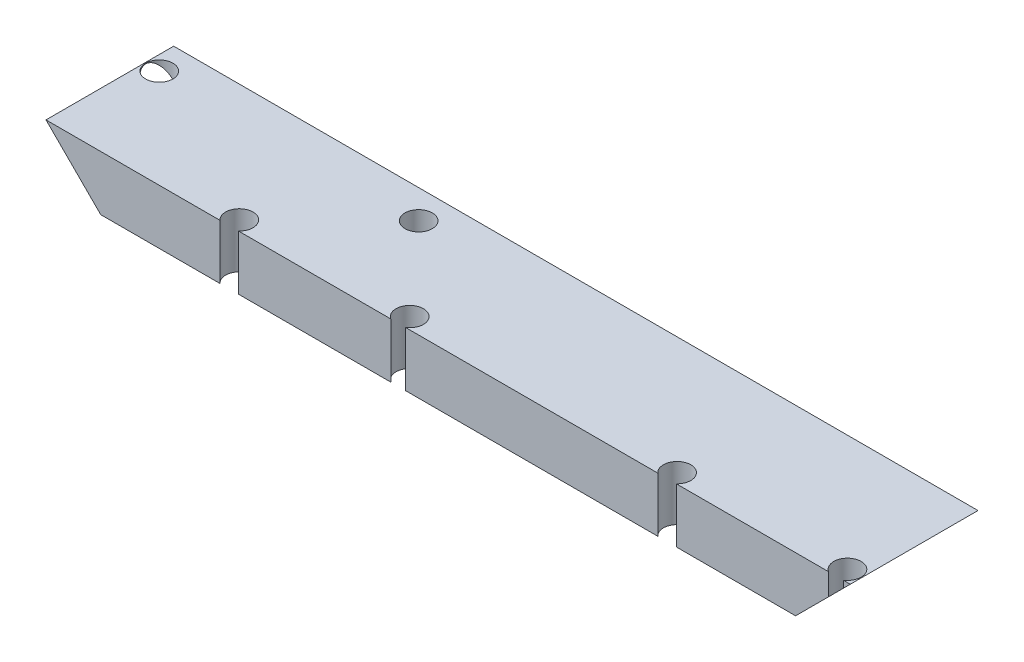
from build123d import *

# Parameters (mm, degrees)
SKETCH1_W                   = 560
SKETCH1_H                   = 88.9
BODY_DEPTH                  = 38.1
MOUNTING_HOLE_SPACING_REACH = 570.291
SKETCH2_R                   = 9.525
CUT_EXTRUDE1_REACH          = 570.291


with BuildPart() as part:
    # Sketch1 → Body (new body)
    with BuildSketch(Plane(origin=(0, 0, 0), x_dir=(1, 0, 0), z_dir=(0, 1, 0))):
        with Locations((280, 44.45)):
            Rectangle(SKETCH1_W, SKETCH1_H)
    extrude(amount=BODY_DEPTH)

    # Sketch2 → Mounting hole spacing (cut, up to next)
    with BuildSketch(Plane(origin=(0, 38.1, 0), x_dir=(1, 0, 0), z_dir=(0, 1, 0)), mode=Mode.PRIVATE) as mounting_hole_spacing_sk1:
        with Locations((127.6, 7)):
            Circle(SKETCH2_R)
    mounting_hole_spacing_tool1 = extrude(mounting_hole_spacing_sk1.sketch, amount=-MOUNTING_HOLE_SPACING_REACH, mode=Mode.PRIVATE) & part.part
    # Sketch2 → Mounting hole spacing (cut, up to next)
    with BuildSketch(Plane(origin=(0, 38.1, 0), x_dir=(1, 0, 0), z_dir=(0, 1, 0)), mode=Mode.PRIVATE) as mounting_hole_spacing_sk2:
        with Locations((190.57, 68.87)):
            Circle(SKETCH2_R)
    mounting_hole_spacing_tool2 = extrude(mounting_hole_spacing_sk2.sketch, amount=-MOUNTING_HOLE_SPACING_REACH, mode=Mode.PRIVATE) & part.part
    # Sketch2 → Mounting hole spacing (cut, up to next)
    with BuildSketch(Plane(origin=(0, 38.1, 0), x_dir=(1, 0, 0), z_dir=(0, 1, 0)), mode=Mode.PRIVATE) as mounting_hole_spacing_sk3:
        with Locations((10, 68.87)):
            Circle(SKETCH2_R)
    mounting_hole_spacing_tool3 = extrude(mounting_hole_spacing_sk3.sketch, amount=-MOUNTING_HOLE_SPACING_REACH, mode=Mode.PRIVATE) & part.part
    # Sketch2 → Mounting hole spacing (cut, up to next)
    with BuildSketch(Plane(origin=(0, 38.1, 0), x_dir=(1, 0, 0), z_dir=(0, 1, 0)), mode=Mode.PRIVATE) as mounting_hole_spacing_sk4:
        with Locations((245.2, 8.02)):
            Circle(SKETCH2_R)
    mounting_hole_spacing_tool4 = extrude(mounting_hole_spacing_sk4.sketch, amount=-MOUNTING_HOLE_SPACING_REACH, mode=Mode.PRIVATE) & part.part
    # Sketch2 → Mounting hole spacing (cut, up to next)
    with BuildSketch(Plane(origin=(0, 38.1, 0), x_dir=(1, 0, 0), z_dir=(0, 1, 0)), mode=Mode.PRIVATE) as mounting_hole_spacing_sk5:
        with Locations((550, 8.02)):
            Circle(SKETCH2_R)
    mounting_hole_spacing_tool5 = extrude(mounting_hole_spacing_sk5.sketch, amount=-MOUNTING_HOLE_SPACING_REACH, mode=Mode.PRIVATE) & part.part
    # Sketch2 → Mounting hole spacing (cut, up to next)
    with BuildSketch(Plane(origin=(0, 38.1, 0), x_dir=(1, 0, 0), z_dir=(0, 1, 0)), mode=Mode.PRIVATE) as mounting_hole_spacing_sk6:
        with Locations((432.4, 7)):
            Circle(SKETCH2_R)
    mounting_hole_spacing_tool6 = extrude(mounting_hole_spacing_sk6.sketch, amount=-MOUNTING_HOLE_SPACING_REACH, mode=Mode.PRIVATE) & part.part
    add(mounting_hole_spacing_tool1.solids().sort_by_distance((127.6, 38.1, -7))[0], mode=Mode.SUBTRACT)
    add(mounting_hole_spacing_tool2.solids().sort_by_distance((190.57, 38.1, -68.87))[0], mode=Mode.SUBTRACT)
    add(mounting_hole_spacing_tool3.solids().sort_by_distance((10, 38.1, -68.87))[0], mode=Mode.SUBTRACT)
    add(mounting_hole_spacing_tool4.solids().sort_by_distance((245.2, 38.1, -8.02))[0], mode=Mode.SUBTRACT)
    add(mounting_hole_spacing_tool5.solids().sort_by_distance((550, 38.1, -8.02))[0], mode=Mode.SUBTRACT)
    add(mounting_hole_spacing_tool6.solids().sort_by_distance((432.4, 38.1, -7))[0], mode=Mode.SUBTRACT)

    # Sketch3 → Cut-Extrude1 (cut, up to next)
    with BuildSketch(Plane(origin=(0, 0, -88.9), x_dir=(-1, 0, 0), z_dir=(0, 0, -1)), mode=Mode.PRIVATE) as cut_extrude1_sk1:
        Polygon((-560, 0), (-560, 38.1), (-521.9, 0), align=None)
    cut_extrude1_tool1 = extrude(cut_extrude1_sk1.sketch, amount=-CUT_EXTRUDE1_REACH, mode=Mode.PRIVATE) & part.part
    # Sketch3 → Cut-Extrude1 (cut, up to next)
    with BuildSketch(Plane(origin=(0, 0, -88.9), x_dir=(-1, 0, 0), z_dir=(0, 0, -1)), mode=Mode.PRIVATE) as cut_extrude1_sk2:
        Polygon((0, 0), (0, 38.1), (-38.1, 0), align=None)
    cut_extrude1_tool2 = extrude(cut_extrude1_sk2.sketch, amount=-CUT_EXTRUDE1_REACH, mode=Mode.PRIVATE) & part.part
    add(cut_extrude1_tool1.solids().sort_by_distance((547.3, 12.7, -88.9))[0], mode=Mode.SUBTRACT)
    add(cut_extrude1_tool2.solids().sort_by_distance((12.7, 12.7, -88.9))[0], mode=Mode.SUBTRACT)


solid = part.part
